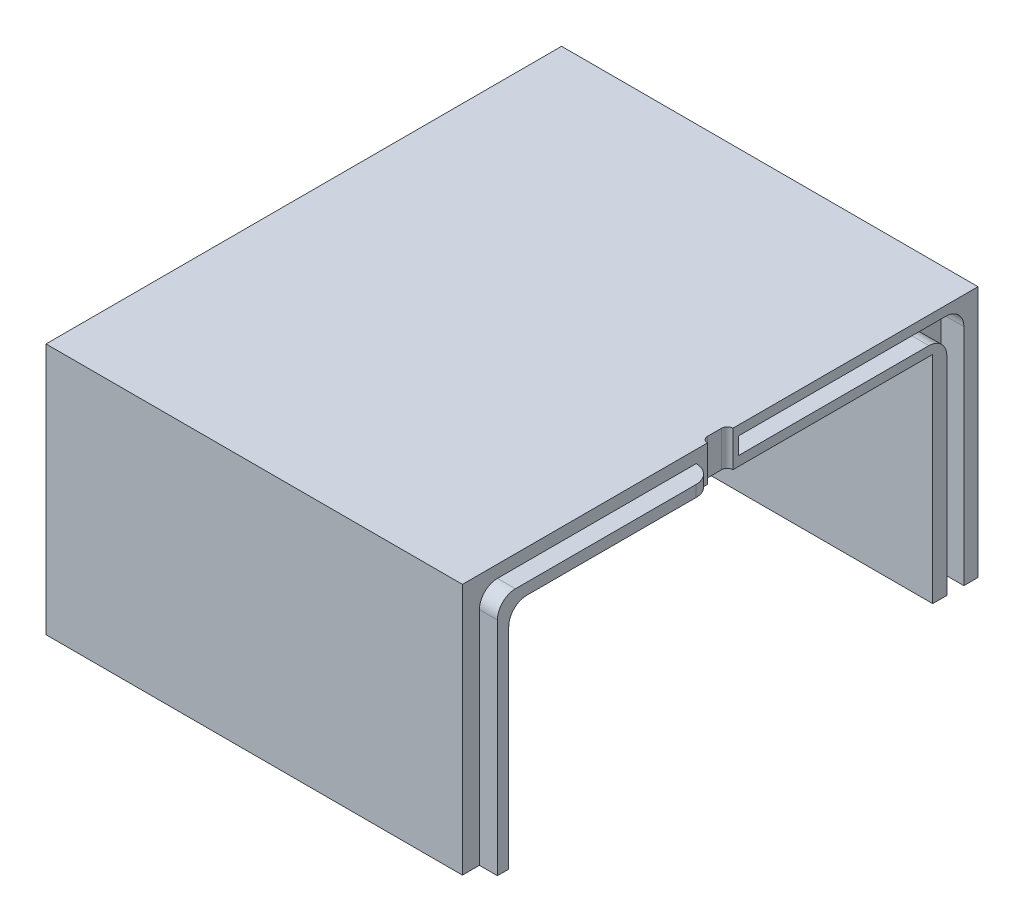
from build123d import *

# Parameters (mm, degrees)
WALL_DEPTH                = 19.05
ROOF_START                = 19.05
ROOF_DEPTH                = 3.175
F_2_56_TAPPED_HOLE1_D     = 1.778
F_2_56_TAPPED_HOLE1_DEPTH = 5.73
F_2_56_TAPPED_HOLE1_TIP   = 0.53416509
BOSS_EXTRUDE1_DEPTH       = 1.5875
CUT_EXTRUDE3_DEPTH        = 2
FILLET1_R                 = 1.5875


with BuildPart() as part:
    # MainSketch → Wall (new body)
    with BuildSketch(Plane(origin=(0, 0, 0), x_dir=(1, 0, 0), z_dir=(0, 1, 0))):
        Polygon((-32.75, -4), (0, -4), (0, 0), (-36.75, 0), (-36.75, -45.5), (0, -45.5), (0, -41.5), (-32.75, -41.5), align=None)
    extrude(amount=WALL_DEPTH)

    # MainSketch<3> → Roof (add)
    with BuildSketch(Plane(origin=(0, 0, 0), x_dir=(1, 0, 0), z_dir=(0, 1, 0)).offset(ROOF_START)):
        with BuildLine():
            Line((0, -21.625), (0, 0))
            Line((0, 0), (-36.75, 0))
            Line((-36.75, 0), (-36.75, -45.5))
            Line((-36.75, -45.5), (0, -45.5))
            Line((0, -45.5), (0, -23.875))
            ThreePointArc((0, -23.875), (-0.353553391, -23.728553391), (-0.5, -23.375))
            Line((-0.5, -23.375), (-0.5, -22.125))
            ThreePointArc((-0.5, -22.125), (-0.353553391, -21.771446609), (0, -21.625))
        make_face()
    extrude(amount=ROOF_DEPTH)

    # #2-56 Tapped Hole1
    with Locations(Plane(origin=(-18.375, 0, 43), x_dir=(0, 0, -1), z_dir=(0, -1, 0))):
        with Locations((0, 0), (40.5, 0)):
            Hole(F_2_56_TAPPED_HOLE1_D / 2, depth=F_2_56_TAPPED_HOLE1_DEPTH)
            with Locations((0, 0, -(F_2_56_TAPPED_HOLE1_DEPTH + F_2_56_TAPPED_HOLE1_TIP / 2))):  # 118° drill point
                Cone(0, F_2_56_TAPPED_HOLE1_D / 2, F_2_56_TAPPED_HOLE1_TIP, mode=Mode.SUBTRACT)

    # Sketch3 → Boss-Extrude1 (add)
    with BuildSketch(Plane(origin=(0, 0, 0), x_dir=(0, 0, -1), z_dir=(1, 0, 0))):
        Polygon((-24.875, 21.1375), (-24.875, 20.1375), (-43, 20.1375), (-43, 0), (-44, 0), (-44, 21.1375), align=None)
    extrude(amount=BOSS_EXTRUDE1_DEPTH)

    # Sketch3<3> → Cut-Extrude3 (cut)
    with BuildSketch(Plane(origin=(0, 0, 0), x_dir=(0, 0, -1), z_dir=(1, 0, 0))):
        Polygon((-21.125, 19.8875), (-21.125, 21.3875), (-1.25, 21.3875), (-1.25, 0), (-2.75, 0), (-2.75, 19.8875), align=None)
    extrude(amount=-CUT_EXTRUDE3_DEPTH, mode=Mode.SUBTRACT)

    # Fillet1
    fillet1_edges = [part.edges().sort_by_distance(p)[0] for p in [
        (0.79375, 20.1375, 43),
        (0.79375, 21.1375, 44),
        (1.5875, 20.6375, 24.875),
        (-1, 21.3875, 1.25),
        (-1, 19.8875, 2.75),
        (-2, 20.6375, 21.125),
    ]]
    fillet(fillet1_edges, radius=FILLET1_R - 0.0001)  # a hair under: the kernel refuses the full size


solid = part.part
